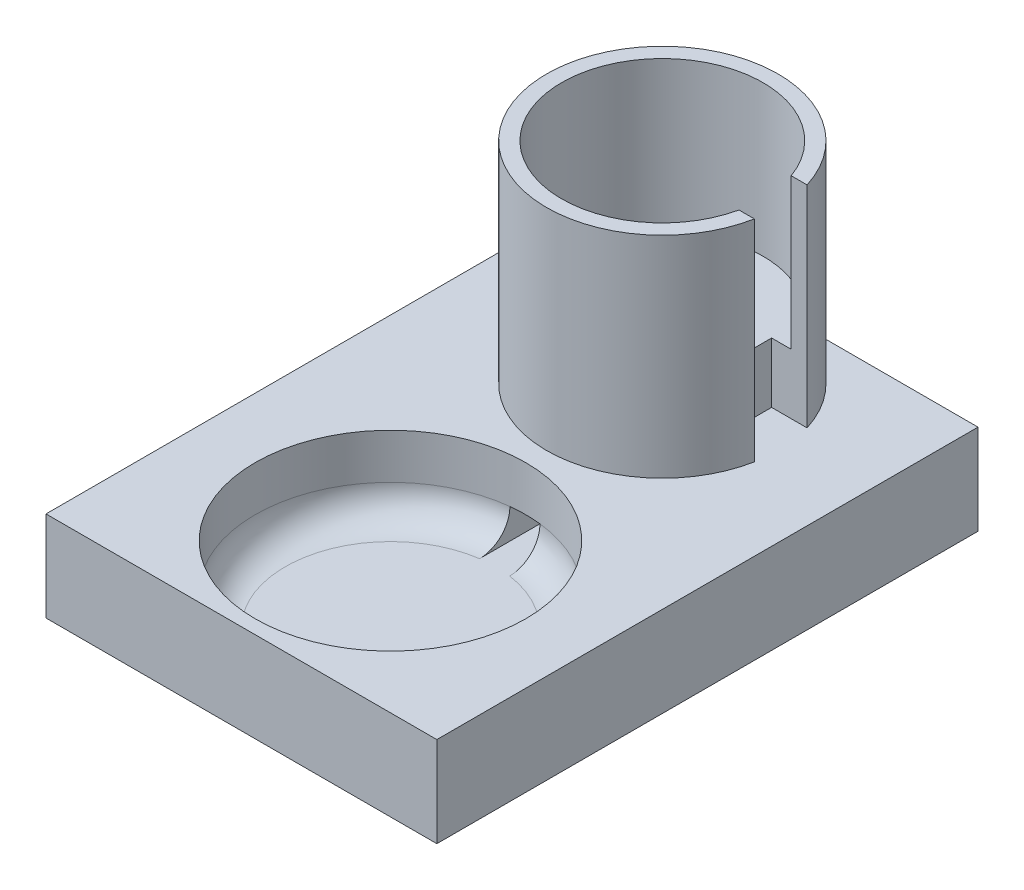
from build123d import *

# Parameters (mm, degrees)
SKETCH_1_W          = 130
SKETCH_1_H          = 30
EXTRUDE_1_DEPTH     = 180
SKETCH_2_R          = 38.5
SKETCH_2_R_2        = 33.5
EXTRUDE_1_2_DEPTH   = 70
SKETCH_3_R          = 45
CUT_EXTRUDE_1_DEPTH = 25
SKETCH_5_R          = 33.5
EXTRUDE_2_DEPTH     = 20
SKETCH_4_R          = 20
CUT_EXTRUDE_2_DEPTH = 40
SKETCH_7_W          = 10
SKETCH_7_H          = 10
CUT_EXTRUDE_3_DEPTH = 130
SKETCH_8_W          = 18.558998623
SKETCH_8_H          = 76.555219483
CUT_EXTRUDE_4_DEPTH = 40
FILLET_START        = 5
FILLET_1_2_DEPTH    = 10


with BuildPart() as part:
    # 草图1 → Extrude 1 (new body)
    with BuildSketch(Plane.XY):
        with Locations((0, 15)):
            Rectangle(SKETCH_1_W, SKETCH_1_H)
    extrude(amount=-EXTRUDE_1_DEPTH)

    # 草图2 → Extrude 1 2 (add)
    with BuildSketch(Plane(origin=(0, 30, 0), x_dir=(1, 0, 0), z_dir=(0, 1, 0))):
        with Locations((0, 140)):
            Circle(SKETCH_2_R)
        with Locations((0, 140)):
            Circle(SKETCH_2_R_2, mode=Mode.SUBTRACT)
    extrude(amount=EXTRUDE_1_2_DEPTH)

    # 草图3 → 切除-拉伸1 (cut)
    with BuildSketch(Plane(origin=(0, 30, 0), x_dir=(1, 0, 0), z_dir=(0, 1, 0))):
        with Locations(Location((0, 49.571769675, 0), (0, 0, 270))):
            Circle(SKETCH_3_R)
    extrude(amount=-CUT_EXTRUDE_1_DEPTH, mode=Mode.SUBTRACT)

    # 草图5 → 凸台-拉伸2 (add)
    with BuildSketch(Plane(origin=(0, 30, 0), x_dir=(1, 0, 0), z_dir=(0, 1, 0))):
        with Locations(Location((0, 140, 0), (0, 0, 270))):
            Circle(SKETCH_5_R)
    extrude(amount=EXTRUDE_2_DEPTH)

    # 草图4 → 切除-拉伸2 (cut)
    with BuildSketch(Plane(origin=(0, 50, 0), x_dir=(1, 0, 0), z_dir=(0, 1, 0))):
        with Locations(Location((0, 140, 0), (0, 0, 270))):
            Circle(SKETCH_4_R)
    extrude(amount=-CUT_EXTRUDE_2_DEPTH, mode=Mode.SUBTRACT)

    # 草图7 → 切除-拉伸3 (cut)
    with BuildSketch(Plane.XY.offset(-20)):
        with Locations((0, 10)):
            Rectangle(SKETCH_7_W, SKETCH_7_H)
    extrude(amount=-CUT_EXTRUDE_3_DEPTH, mode=Mode.SUBTRACT)

    # 草图8 → 切除-拉伸4 (cut)
    with BuildSketch(Plane(origin=(65, 0, 0), x_dir=(0, 0, -1), z_dir=(1, 0, 0))):
        with Locations((142.072443273, 68.277609742)):
            Rectangle(SKETCH_8_W, SKETCH_8_H)
    extrude(amount=-CUT_EXTRUDE_4_DEPTH, mode=Mode.SUBTRACT)

    # 圆角1: read off the stored shape, not the designer's step
    # 圆角1 outline → 圆角1 (revolve)
    with BuildSketch(Plane.XY.offset(-49.571769675)):
        with BuildLine():
            ThreePointArc((45, 15), (42.071067812, 7.928932188), (35, 5))
            Line((35, 5), (45, 5))
            Line((45, 5), (45, 15))
        make_face()
    revolve(axis=Axis((0, 0, -49.571769675), (0, 1, 0)))

    # Fillet 1 2 outline → Fillet 1 2 (cut)
    with BuildSketch(Plane(origin=(0, 0, 0), x_dir=(1, 0, 0), z_dir=(0, 1, 0)).offset(FILLET_START)):
        with BuildLine():
            Line((-5, 150), (-5, 84.212785827))
            ThreePointArc((-5, 84.212785827), (0, 14.571769675), (5, 84.212785827))
            Line((5, 84.212785827), (5, 150))
            Line((5, 150), (-5, 150))
        make_face()
    extrude(amount=FILLET_1_2_DEPTH, mode=Mode.SUBTRACT)


solid = part.part
